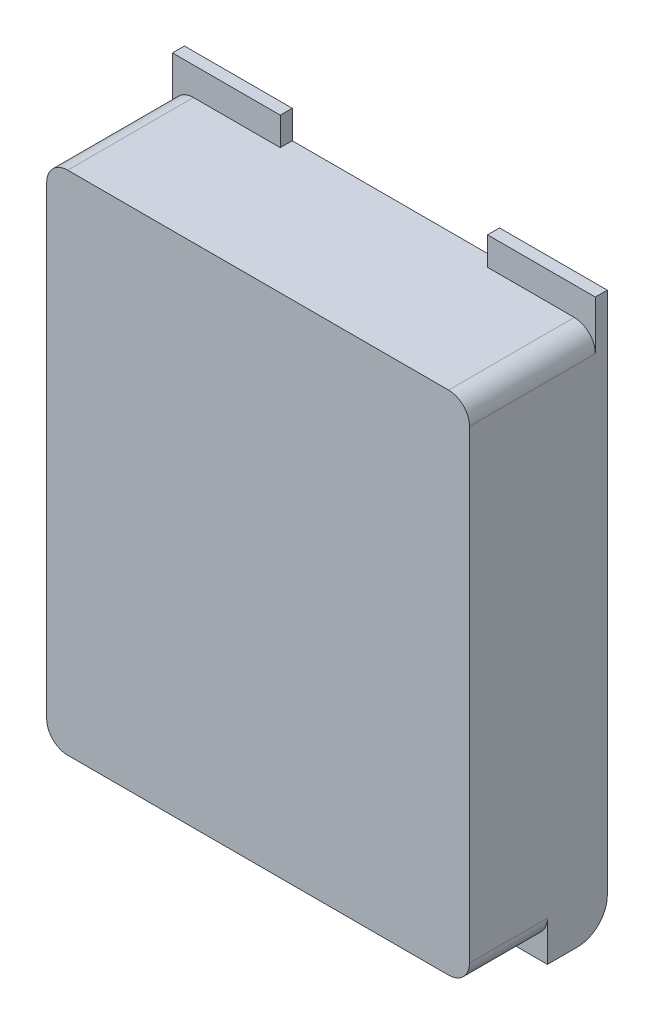
from build123d import *

# Parameters (mm, degrees)
SKETCH_1_W               = 70.6
SKETCH_1_H               = 84.6
EXTRUDE_1_DEPTH          = 23
SKETCH_2_W               = 18
SKETCH_2_H               = 4.7
EXTRUDE_2_DEPTH          = 2
SKETCH_3_W               = 70.6
SKETCH_3_H               = 3.2
EXTRUDE_3_DEPTH          = 10
CUT_EXTRUDE_START        = -2
SKETCH_4_R               = 11
CUT_EXTRUDE_1_DEPTH      = 115.979827321
EXTRUDE_START            = -2
EXTRUDE_1_2_DEPTH        = 2
DELETE_START             = 107
DELETE_FACE_1_DEPTH      = 2
CUT_EXTRUDE_2_DEPTH      = 1
CUT_EXTRUDE_2_DEPTH_BACK = 43
CUT_EXTRUDE_2_START      = -2
EXTRUDE_START_2          = 24
EXTRUDE_4_DEPTH          = 2
FILLET_1_R               = 5
FILLET_2_R               = 3.5
FILLET_3_R               = 3.5


# Read off the part's stored shape, not the designer's step: 删除面1
with BuildPart() as part:
    # 草图1 → Extrude 1 (new body)
    with BuildSketch(Plane.XY):
        with Locations((38.5, 152.5)):
            Rectangle(SKETCH_1_W, SKETCH_1_H)
    extrude(amount=-EXTRUDE_1_DEPTH)

    # 草图2 → 凸台-拉伸2 (add)
    with BuildSketch(Plane(origin=(0, 0, -23), x_dir=(-1, 0, 0), z_dir=(0, 0, -1))):
        with Locations((-12.2, 197.15)):
            Rectangle(SKETCH_2_W, SKETCH_2_H)
        with Locations((-64.8, 197.15)):
            Rectangle(SKETCH_2_W, SKETCH_2_H)
    extrude(amount=-EXTRUDE_2_DEPTH)

    # 草图3 → 凸台-拉伸3 (add)
    with BuildSketch(Plane(origin=(0, 0, -23), x_dir=(-1, 0, 0), z_dir=(0, 0, -1))):
        with Locations((-38.5, 108.6)):
            Rectangle(SKETCH_3_W, SKETCH_3_H)
    extrude(amount=-EXTRUDE_3_DEPTH)

    # 草图4 → 切除-拉伸1 (cut, through all)
    with BuildSketch(Plane(origin=(0, 194.8, 0), x_dir=(1, 0, 0), z_dir=(0, 1, 0)).offset(CUT_EXTRUDE_START)):
        with Locations((60.8, 25)):
            Circle(SKETCH_4_R)
    extrude(amount=-CUT_EXTRUDE_1_DEPTH, mode=Mode.SUBTRACT)

    # 草图5 → Extrude 1 2 (add)
    with BuildSketch(Plane.XZ.offset(-107).offset(EXTRUDE_START)):
        with BuildLine():
            ThreePointArc((71.616653826, -23), (60.8, -14), (49.983346174, -23))
            Line((49.983346174, -23), (51.950010506, -23.363636364))
            ThreePointArc((51.950010506, -23.363636364), (60.8, -16), (69.649989494, -23.363636364))
            Line((69.649989494, -23.363636364), (71.616653826, -23))
        make_face()
    extrude(amount=EXTRUDE_1_2_DEPTH)

    # Delete Face 1 outline → Delete Face 1 (cut)
    with BuildSketch(Plane(origin=(0, 0, 0), x_dir=(1, 0, 0), z_dir=(0, 1, 0)).offset(DELETE_START)):
        with BuildLine():
            Line((49.983346174, 23), (52.025035613, 23))
            ThreePointArc((52.025035613, 23), (51.985647631, 23.181431245), (51.950010506, 23.363636364))
            Line((51.950010506, 23.363636364), (49.983346174, 23))
        make_face()
        with BuildLine():
            Line((71.616653826, 23), (69.649989494, 23.363636364))
            ThreePointArc((69.649989494, 23.363636364), (69.614352369, 23.181431245), (69.574964387, 23))
            Line((69.574964387, 23), (71.616653826, 23))
        make_face()
    extrude(amount=DELETE_FACE_1_DEPTH, mode=Mode.SUBTRACT)

    # 草图6 → 切除-拉伸2 (cut, two sides: drawn at the far end of the back side and taken through both)
    with BuildSketch(Plane.ZY.offset(-3.2).offset(CUT_EXTRUDE_2_START - CUT_EXTRUDE_2_DEPTH_BACK)):
        Polygon((-23, 107), (-15, 107), (-15, 112.2), (-2, 112.2), (-2, 192.8), (-23, 192.8), align=None)
    extrude(amount=CUT_EXTRUDE_2_DEPTH + CUT_EXTRUDE_2_DEPTH_BACK, mode=Mode.SUBTRACT)

    # 草图7 → 凸台-拉伸4 (add)
    with BuildSketch(Plane(origin=(4.2, 0, 0), x_dir=(0, 0, -1), z_dir=(1, 0, 0)).offset(EXTRUDE_START_2)):
        Polygon((23, 107), (23, 192.8), (2, 192.8), (2, 112.2), (15, 112.2), (15, 107), align=None)
    extrude(amount=EXTRUDE_4_DEPTH)

    # 圆角1
    fillet_1_edges = [part.edges().sort_by_distance(p)[0] for p in [
        (71.687482194, 107, -23),
        (50.112517807, 107, -23),
        (29.2, 107, -23),
        (3.7, 107, -23),
    ]]
    fillet(fillet_1_edges, radius=FILLET_1_R)

    # 圆角2
    fillet_2_edges = [part.edges().sort_by_distance(p)[0] for p in [
        (73.8, 194.8, -10.5),
        (3.2, 194.8, -10.5),
        (3.2, 110.2, -6.5),
        (73.8, 110.2, -6.5),
    ]]
    fillet(fillet_2_edges, radius=FILLET_2_R)

    # 圆角3
    fillet_3_edges = [part.edges().sort_by_distance(p)[0] for p in [
        (39.2, 192.8, -2),
        (39.2, 112.2, -2),
        (28.2, 192.8, -12.5),
        (28.2, 152.5, -2),
        (28.2, 112.2, -8.5),
        (30.2, 192.8, -12.5),
        (30.2, 152.5, -2),
        (30.2, 112.2, -8.5),
        (48.2, 112.2, -8.5),
        (16.2, 112.2, -2),
        (48.2, 152.5, -2),
        (16.2, 192.8, -2),
        (48.2, 192.8, -12.5),
        (4.2, 112.2, -8.5),
        (4.2, 152.5, -2),
        (4.2, 192.8, -12.5),
    ]]
    fillet(fillet_3_edges, radius=FILLET_3_R)


solid = part.part
